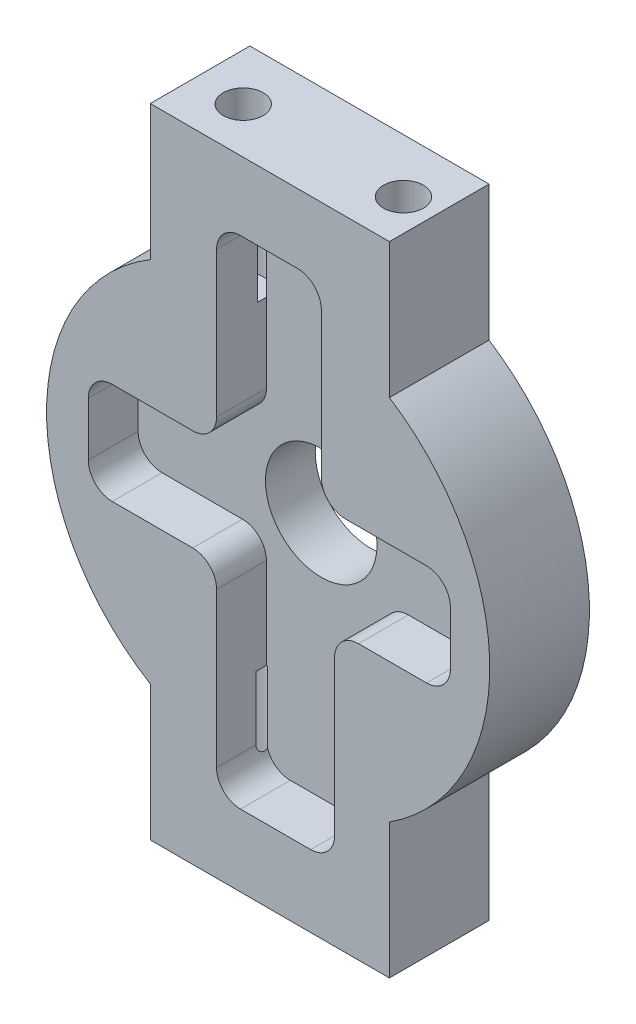
from build123d import *

# Parameters (mm, degrees)
SKETCH1_R           = 2.8
BOSS_EXTRUDE1_DEPTH = 5
CUT_EXTRUDE1_DEPTH  = 2.5
FILLET1_R           = 1.2
SKETCH3_R           = 1
CUT_EXTRUDE2_DEPTH  = 8
SKETCH4_R           = 1
CUT_EXTRUDE3_DEPTH  = 8


with BuildPart() as part:
    # Sketch1 → Boss-Extrude1 (new body)
    with BuildSketch(Plane.XY.offset(10)):
        with BuildLine():
            Line((-253, 240), (-241, 240))
            Line((-241, 240), (-241, 233.219543457))
            ThreePointArc((-241, 233.219543457), (-235.964643127, 224), (-241, 214.780456543))
            Line((-241, 214.780456543), (-241, 208))
            Line((-241, 208), (-253, 208))
            Line((-253, 208), (-253, 214.780456543))
            ThreePointArc((-253, 214.780456543), (-258.20228405, 224), (-253, 233.219543457))
            Line((-253, 233.219543457), (-253, 240))
        make_face()
        with Locations((-246.922635101, 224)):
            Circle(SKETCH1_R, mode=Mode.SUBTRACT)
    extrude(amount=BOSS_EXTRUDE1_DEPTH)

    # Sketch2 → Cut-Extrude1 (cut)
    with BuildSketch(Plane.XY.offset(15)):
        Polygon((-249.671711, 236.526764937), (-244.414971283, 236.526764937), (-244.414971283, 226.843297037), (-237.940881316, 226.843297037), (-237.940881316, 221.752559627), (-243.750962055, 221.752559627), (-243.750962055, 211.604094919), (-249.671711, 211.604094919), (-249.671711, 221.752559627), (-256.108895334, 221.752559627), (-256.108895334, 226.843297037), (-249.671711, 226.843297037), align=None)
    extrude(amount=-CUT_EXTRUDE1_DEPTH, mode=Mode.SUBTRACT)

    # Fillet1
    fillet1_edges = [part.edges().sort_by_distance(p)[0] for p in [
        (-256.108895334, 226.843297037, 13.75),
        (-256.108895334, 221.752559627, 13.75),
        (-249.671711, 221.752559627, 13.75),
        (-249.671711, 211.604094919, 13.75),
        (-243.750962055, 211.604094919, 13.75),
        (-243.750962055, 221.752559627, 13.75),
        (-237.940881316, 221.752559627, 13.75),
        (-237.940881316, 226.843297037, 13.75),
        (-244.414971283, 226.843297037, 13.75),
        (-249.671711, 226.843297037, 13.75),
        (-249.671711, 236.526764937, 13.75),
        (-244.414971283, 236.526764937, 13.75),
    ]]
    fillet(fillet1_edges, radius=FILLET1_R)

    # Sketch3 → Cut-Extrude2 (cut)
    with BuildSketch(Plane(origin=(0, 208, 0), x_dir=(-1, 0, 0), z_dir=(0, -1, 0))):
        with Locations((250.6, -12.657189895)):
            Circle(SKETCH3_R)
        with Locations((242.6, -12.657189895)):
            Circle(SKETCH3_R)
    extrude(amount=-CUT_EXTRUDE2_DEPTH, mode=Mode.SUBTRACT)

    # Sketch4 → Cut-Extrude3 (cut)
    with BuildSketch(Plane(origin=(0, 240, 0), x_dir=(1, 0, 0), z_dir=(0, 1, 0))):
        with Locations((-242.598801613, -12.694978247)):
            Circle(SKETCH4_R)
        with Locations((-250.64051394, -12.694978247)):
            Circle(SKETCH4_R)
    extrude(amount=-CUT_EXTRUDE3_DEPTH, mode=Mode.SUBTRACT)


solid = part.part
